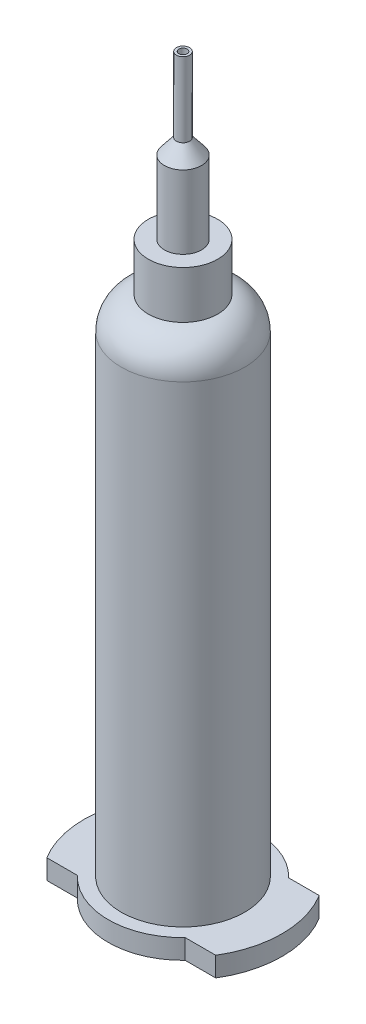
from build123d import *

# Parameters (mm, degrees)
FILLET1_R           = 5
CUT_EXTRUDE1_START  = -3
CUT_EXTRUDE1_DEPTH  = 3
SKETCH4_R           = 7.925
CUT_EXTRUDE2_DEPTH  = 74.00000000000003
SKETCH5_R           = 0.6273709550774836
CUT_EXTRUDE3_DEPTH  = 41.000000000000014
FILLET3_R           = 10
SKETCH6_R           = 7.925
BOSS_EXTRUDE2_DEPTH = 14.999999999999993


with BuildPart() as part:
    # Sketch2 → Revolve1 (revolve)
    with BuildSketch(Plane.XY, mode=Mode.PRIVATE) as revolve1_sk:
        Polygon((15.075000000000022, -55.88), (1.501e-14, -55.88), (1.501e-14, 55.88), (1.0000000000000149, 55.88), (1.0000000000000162, 44.53000000000001), (2.8250000000000046, 42.24483084777286), (2.8250000000000046, 31.120000000000005), (5.275000000000006, 31.120000000000005), (5.275000000000007, 23.880000000000006), (9.399999999999993, 23.880000000000006), (9.400000000000018, -52.88), (15.075000000000019, -52.88), align=None)
    revolve(revolve1_sk.sketch.rotate(Axis((0, 24.52235384982656, 0), (0, -1, 0)), 90), axis=Axis((0, 24.52235384982656, 0), (0, -1, 0)))

    # Fillet1
    # the kernel refuses this fillet: 5 mm, written as the material it takes off along each edge
    with BuildSketch(Plane(origin=(0, 23.880000000000006, 0), x_dir=(1.1e-16, 0, 1), z_dir=(1, 0, -1.1e-16))) as fillet1_piece_1:
        with BuildLine():
            CenterArc((4.399999999999994, 4.922842166879736), FILLET1_R, 280.07865810778594, 79.92134189221406)
            Line((9.399999999999995, 4.922842166879736), (9.499999999999995, 4.922842166879736))
            Line((9.499999999999995, 4.922842166879736), (9.499999999999993, 0))
            Line((9.499999999999993, 0), (9.399999999999993, -0.10000000000000142))
            ThreePointArc((9.399999999999993, -0.10000000000000142), (7.3374999999999195, -0.10000000000000142), (5.292499999999843, -0.09845684333667037))
            Line((5.292499999999843, -0.09845684333667037), (5.274999999999846, 9.0594e-13))
        make_face()
    revolve(axis=Axis((0, 23.880000000000006, 0), (0, -1, 0)), mode=Mode.SUBTRACT)

    # Sketch3 → Cut-Extrude1 (cut)
    with BuildSketch(Plane(origin=(0, -52.88, 0), x_dir=(1, 0, 0), z_dir=(0, 1, 0)).offset(CUT_EXTRUDE1_START)):
        with BuildLine():
            Line((-12.854571171377149, 7.875), (-8.208227579691002, 7.875))
            ThreePointArc((-8.208227579691002, 7.875), (7e-16, 11.375), (8.208227579691002, 7.875))
            Line((8.208227579691002, 7.875), (12.854571171377149, 7.875))
            ThreePointArc((12.854571171377149, 7.875), (-2.42e-15, 15.075000000000015), (-12.854571171377149, 7.875))
        make_face()
        with BuildLine():
            Line((-12.854571171377149, -7.875), (-8.208227579691002, -7.875))
            ThreePointArc((-8.208227579691002, -7.875), (7e-16, -11.375), (8.208227579691002, -7.875))
            Line((8.208227579691002, -7.875), (12.854571171377149, -7.875))
            ThreePointArc((12.854571171377149, -7.875), (-2.42e-15, -15.075000000000015), (-12.854571171377149, -7.875))
        make_face()
    extrude(amount=CUT_EXTRUDE1_DEPTH, mode=Mode.SUBTRACT)

    # Sketch4 → Cut-Extrude2 (cut)
    with BuildSketch(Plane.XZ.offset(55.88)):
        with Locations(Location((0, 0, 0), (0, 0, 270))):
            Circle(SKETCH4_R)
    extrude(amount=-CUT_EXTRUDE2_DEPTH, mode=Mode.SUBTRACT)

    # Sketch5 → Cut-Extrude3 (cut)
    with BuildSketch(Plane(origin=(0, 55.88, 0), x_dir=(1, 0, 0), z_dir=(0, 1, 0))):
        with Locations(Location((0, 0, 0), (0, 0, 270))):
            Circle(SKETCH5_R)
    extrude(amount=-CUT_EXTRUDE3_DEPTH, mode=Mode.SUBTRACT)

    # Fillet3
    # the kernel refuses this fillet: 10 mm, written as the material it takes off along each edge
    with BuildSketch(Plane(origin=(0, 18.120000000000026, 0), x_dir=(-1.8e-16, 0, 1), z_dir=(-1, 0, -1.8e-16))) as fillet3_piece_1:
        with BuildLine():
            CenterArc((10.627370955077483, 9.627938056570244), FILLET3_R, 180, 74.32162410207388)
            Line((0.6273709550774829, 9.627938056570244), (0.42737095507748285, 9.627938056570244))
            Line((0.42737095507748285, 9.627938056570244), (0.4273709550774836, 0))
            Line((0.4273709550774836, 0), (0.6273709550774836, -0.1999999999999993))
            ThreePointArc((0.6273709550774836, -0.1999999999999993), (4.276185477538742, -0.1999999999999993), (7.87095258089845, -0.19255876113140502))
            Line((7.87095258089845, -0.19255876113140502), (7.925, 0))
        make_face()
    revolve(axis=Axis((0, 18.120000000000026, 0), (0, 1, 0)), mode=Mode.SUBTRACT)


with BuildPart() as body_2:
    # Sketch6 → Boss-Extrude2 (new body)
    with BuildSketch(Plane(origin=(0, 18.120000000000015, 0), x_dir=(1, 0, 0), z_dir=(0, 1, 0))):
        with Locations(Location((0, 0, 0), (0, 0, 270))):
            Circle(SKETCH6_R)
    extrude(amount=-BOSS_EXTRUDE2_DEPTH)


solid = Compound([part.part, body_2.part])
